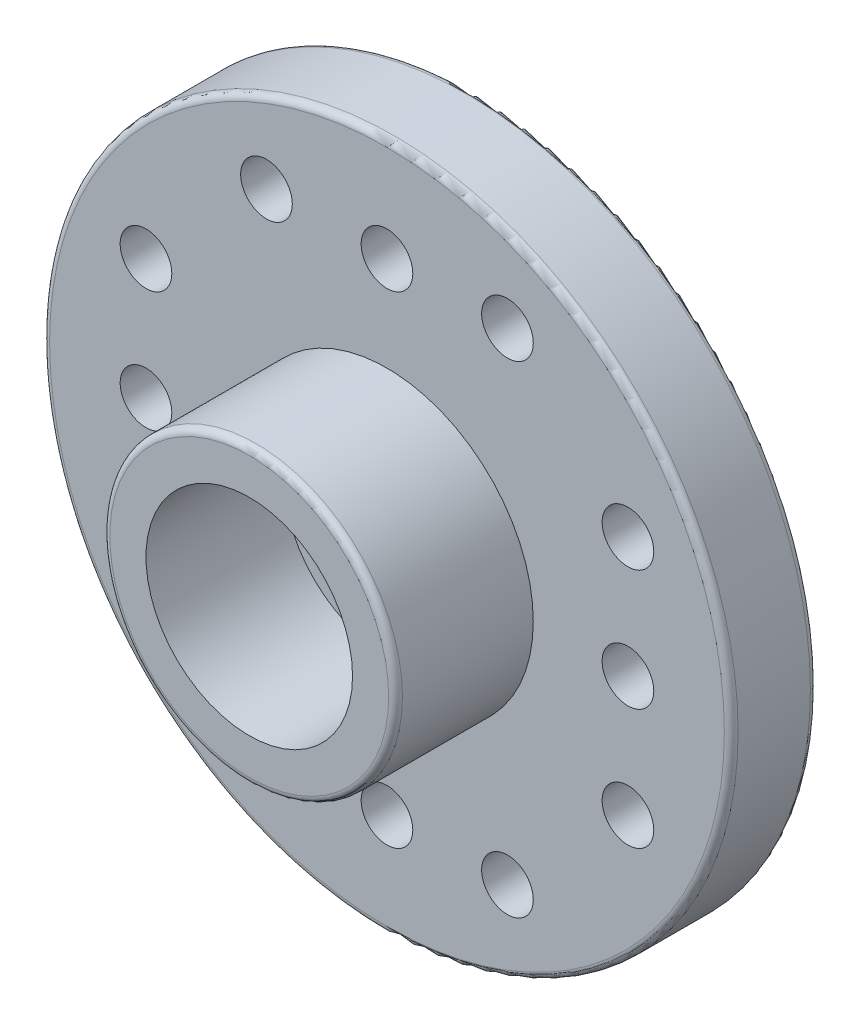
from build123d import *

# Parameters (mm, degrees)
SKETCH1_R           = 10
SKETCH1_R_2         = 0.75
SKETCH1_R_3         = 1.5
BOSS_EXTRUDE1_DEPTH = 2.5
SKETCH5_R           = 4.25
SKETCH5_R_2         = 3
BOSS_EXTRUDE2_DEPTH = 4
SKETCH6_R           = 3.5
CUT_EXTRUDE1_DEPTH  = 0.8
FILLET1_R           = 0.2


with BuildPart() as part:
    # Sketch1 → Boss-Extrude1 (new body)
    with BuildSketch(Plane.XY):
        Circle(SKETCH1_R)
        with Locations((-7, 0)):
            Circle(SKETCH1_R_2, mode=Mode.SUBTRACT)
        with Locations((3.5, 7)):
            Circle(SKETCH1_R_2, mode=Mode.SUBTRACT)
        with Locations((0, 7)):
            Circle(SKETCH1_R_2, mode=Mode.SUBTRACT)
        with Locations((-3.5, 7)):
            Circle(SKETCH1_R_2, mode=Mode.SUBTRACT)
        with Locations((7, -3.5)):
            Circle(SKETCH1_R_2, mode=Mode.SUBTRACT)
        with Locations((7, 0)):
            Circle(SKETCH1_R_2, mode=Mode.SUBTRACT)
        with Locations((7, 3.5)):
            Circle(SKETCH1_R_2, mode=Mode.SUBTRACT)
        with Locations((-3.5, -7)):
            Circle(SKETCH1_R_2, mode=Mode.SUBTRACT)
        with Locations((0, -7)):
            Circle(SKETCH1_R_2, mode=Mode.SUBTRACT)
        with Locations((3.5, -7)):
            Circle(SKETCH1_R_2, mode=Mode.SUBTRACT)
        with Locations((-7, -3.5)):
            Circle(SKETCH1_R_2, mode=Mode.SUBTRACT)
        with Locations((-7, 3.5)):
            Circle(SKETCH1_R_2, mode=Mode.SUBTRACT)
        Circle(SKETCH1_R_3, mode=Mode.SUBTRACT)
    extrude(amount=BOSS_EXTRUDE1_DEPTH)

    # Sketch5 → Boss-Extrude2 (add)
    with BuildSketch(Plane.XY.offset(2.5)):
        Circle(SKETCH5_R)
        Circle(SKETCH5_R_2, mode=Mode.SUBTRACT)
    extrude(amount=BOSS_EXTRUDE2_DEPTH)

    # Sketch6 → Cut-Extrude1 (cut)
    with BuildSketch(Plane(origin=(0, 0, 0), x_dir=(-1, 0, 0), z_dir=(0, 0, -1))):
        Circle(SKETCH6_R)
    extrude(amount=-CUT_EXTRUDE1_DEPTH, mode=Mode.SUBTRACT)

    # Fillet1
    fillet1_edges = [part.edges().sort_by_distance(p)[0] for p in [
        (-10, 0, 0),
        (-10, 0, 2.5),
        (3.5, 0, 0),
        (-4.25, 0, 6.5),
    ]]
    fillet(fillet1_edges, radius=FILLET1_R)


solid = part.part
